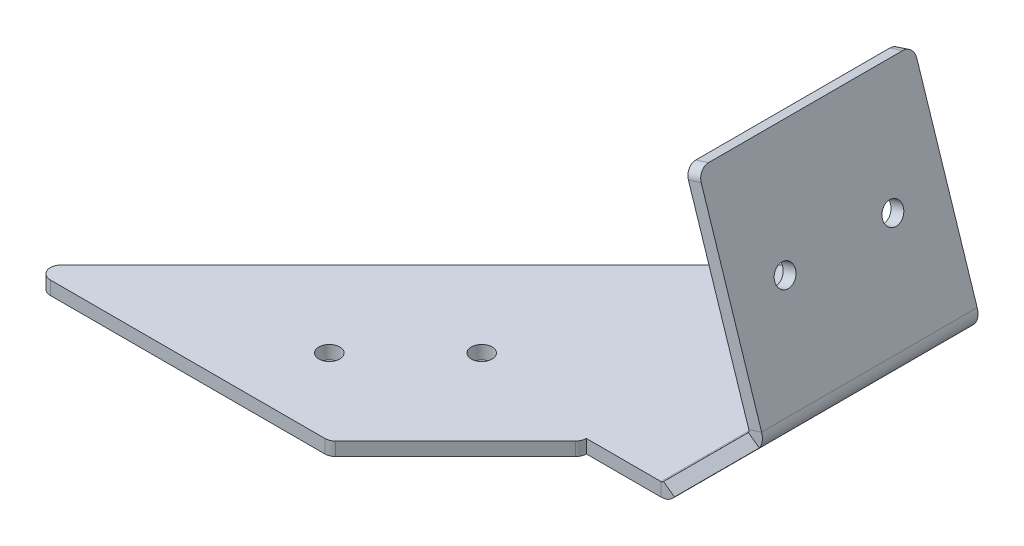
from build123d import *

# Parameters (mm, degrees)
SKETCH1_R                  = 2.4638
BASE_FLANGE1_DEPTH         = 3.175
SKETCHED_START             = -25.4
SKETCHED_BEND1_DEPTH       = 70.78994652
SKETCHED_START_2           = 25.4
SKETCHED_BEND1_2_DEPTH     = 19.98994652
SKETCHED_START_3           = -10.2361999
SKETCHED_BEND1_3_DEPTH     = 20.4723998
SKETCHED_START_4           = -22.86
SKETCHED_BEND1_4_DEPTH     = 7.6961999
SKETCHED_START_5           = 15.1638001
SKETCHED_BEND1_5_DEPTH     = 7.6961999
SKETCHED_BEND1_6_DEPTH     = 70.78994652
SKETCHED_BEND1_7_DEPTH     = 50.8
SKETCHED_START_6           = -15.866732383
SKETCHED_BEND1_8_OUTLINE_R = 2.4638
SKETCHED_BEND1_8_DEPTH     = 3.866732383


with BuildPart() as part:
    # Base-Flange1: sheet metal written as solids
    # Sketch1 → Base-Flange1 (new body)
    with BuildSketch(Plane(origin=(0, 0, 0), x_dir=(1, 0, 0), z_dir=(0, 1, 0))):
        with BuildLine():
            Line((-35.2933, 25.4), (-132.557248776, -71.863948776))
            ThreePointArc((-132.557248776, -71.863948776), (-133.107851564, -74.632015918), (-130.761197552, -76.2))
            Line((-130.761197552, -76.2), (-66.10335348, -76.2))
            ThreePointArc((-66.10335348, -76.2), (-65.131337562, -76.006654013), (-64.307302256, -75.456051224))
            Line((-64.307302256, -75.456051224), (-36.037248776, -47.185997744))
            ThreePointArc((-36.037248776, -47.185997744), (-35.486645987, -46.361962438), (-35.2933, -45.38994652))
            Line((-35.2933, -45.38994652), (-15.5067, -45.38994652))
            Line((-15.5067, -45.38994652), (-15.5067, -25.4))
            Line((-15.5067, -25.4), (32.7533, -25.4))
            ThreePointArc((32.7533, -25.4), (34.549351224, -24.656051224), (35.2933, -22.86))
            Line((35.2933, -22.86), (35.2933, 22.86))
            ThreePointArc((35.2933, 22.86), (34.549351224, 24.656051224), (32.7533, 25.4))
            Line((32.7533, 25.4), (-35.2933, 25.4))
        make_face()
        with Locations(Location((-83.011763274, -58.239487758, 0), (0, 0, 270))):
            Circle(SKETCH1_R, mode=Mode.SUBTRACT)
        with Locations(Location((-65.051251031, -40.278975516, 0), (0, 0, 270))):
            Circle(SKETCH1_R, mode=Mode.SUBTRACT)
        with Locations(Location((9.8933, -12.7, 0), (0, 0, 270))):
            Circle(SKETCH1_R, mode=Mode.SUBTRACT)
        with Locations(Location((9.8933, 12.7, 0), (0, 0, 270))):
            Circle(SKETCH1_R, mode=Mode.SUBTRACT)
    extrude(amount=-BASE_FLANGE1_DEPTH)

    # Sketched Bend1: read off the stored shape, not the designer's step
    # Sketched Bend1 outline → Sketched Bend1 (cut)
    with BuildSketch(Plane.XY.offset(SKETCHED_START)):
        with BuildLine():
            Line((35.2933, 0), (-13.855493847, 0))
            ThreePointArc((-13.855493847, 0), (-15.205192704, -2.278520157), (-17.697112646, -3.175))
            Line((-17.697112646, -3.175), (35.2933, -3.175))
            Line((35.2933, -3.175), (35.2933, 0))
        make_face()
    extrude(amount=SKETCHED_BEND1_DEPTH, mode=Mode.SUBTRACT)

    # Sketched Bend1 2 outline → Sketched Bend1 2 (cut)
    with BuildSketch(Plane.XY.offset(SKETCHED_START_2)):
        Polygon((-15.5067, -0.854827941), (-15.5067, 0), (-16.683269724, 0), align=None)
    extrude(amount=SKETCHED_BEND1_2_DEPTH, mode=Mode.SUBTRACT)

    # Sketched Bend1 3 outline → Sketched Bend1 3 (add)
    with BuildSketch(Plane.XY.offset(SKETCHED_START_3)):
        with BuildLine():
            ThreePointArc((-13.855493847, 0), (-13.793115407, 0.98036242), (-13.976959977, 1.945350875))
            Line((-13.976959977, 1.945350875), (-28.998148559, 48.175815683))
            Line((-28.998148559, 48.175815683), (-32.017752998, 47.194686726))
            Line((-32.017752998, 47.194686726), (-16.996564416, 0.964221918))
            ThreePointArc((-16.996564416, 0.964221918), (-17.101190728, 0.303637383), (-17.697112646, 0))
            Line((-17.697112646, 0), (-13.855493847, 0))
        make_face()
    extrude(amount=SKETCHED_BEND1_3_DEPTH)

    # Sketched Bend1 4 outline → Sketched Bend1 4 (add)
    with BuildSketch(Plane.XY.offset(SKETCHED_START_4)):
        with BuildLine():
            ThreePointArc((-13.855493847, 0), (-13.793115407, 0.98036242), (-13.976959977, 1.945350875))
            Line((-13.976959977, 1.945350875), (-28.998148559, 48.175815683))
            Line((-28.998148559, 48.175815683), (-32.017752998, 47.194686726))
            Line((-32.017752998, 47.194686726), (-16.996564416, 0.964221918))
            ThreePointArc((-16.996564416, 0.964221918), (-17.101190728, 0.303637383), (-17.697112646, 0))
            Line((-17.697112646, 0), (-13.855493847, 0))
        make_face()
    extrude(amount=SKETCHED_BEND1_4_DEPTH)

    # Sketched Bend1 5 outline → Sketched Bend1 5 (add)
    with BuildSketch(Plane.XY.offset(SKETCHED_START_5)):
        with BuildLine():
            ThreePointArc((-13.855493847, 0), (-13.793115407, 0.98036242), (-13.976959977, 1.945350875))
            Line((-13.976959977, 1.945350875), (-28.998148559, 48.175815683))
            Line((-28.998148559, 48.175815683), (-32.017752998, 47.194686726))
            Line((-32.017752998, 47.194686726), (-16.996564416, 0.964221918))
            ThreePointArc((-16.996564416, 0.964221918), (-17.101190728, 0.303637383), (-17.697112646, 0))
            Line((-17.697112646, 0), (-13.855493847, 0))
        make_face()
    extrude(amount=SKETCHED_BEND1_5_DEPTH)

    # Sketched Bend1 6 outline → Sketched Bend1 6 (add)
    with BuildSketch(Plane.XY.offset(SKETCHED_START)):
        with BuildLine():
            ThreePointArc((-15.5067, -2.504188021), (-14.978553355, -2.0758811), (-14.532561771, -1.562580793))
            Line((-14.532561771, -1.562580793), (-15.5067, -0.854827941))
            Line((-15.5067, -0.854827941), (-15.5067, -2.504188021))
        make_face()
        with BuildLine():
            Line((-17.697112646, 0), (-16.683269724, 0))
            Line((-16.683269724, 0), (-17.101190728, 0.303637383))
            ThreePointArc((-17.101190728, 0.303637383), (-17.362703244, 0.080284594), (-17.697112646, 0))
        make_face()
    extrude(amount=SKETCHED_BEND1_6_DEPTH)

    # Sketched Bend1 7 outline → Sketched Bend1 7 (add)
    with BuildSketch(Plane.XY.offset(SKETCHED_START)):
        with BuildLine():
            ThreePointArc((-13.855493847, 0), (-13.793115407, 0.98036242), (-13.976959977, 1.945350875))
            Line((-13.976959977, 1.945350875), (-28.998148559, 48.175815683))
            Line((-28.998148559, 48.175815683), (-32.017752998, 47.194686726))
            Line((-32.017752998, 47.194686726), (-16.996564416, 0.964221918))
            ThreePointArc((-16.996564416, 0.964221918), (-16.969581414, 0.621370373), (-17.101190728, 0.303637383))
            Line((-17.101190728, 0.303637383), (-16.683269724, 0))
            Line((-16.683269724, 0), (-13.855493847, 0))
        make_face()
    extrude(amount=SKETCHED_BEND1_7_DEPTH)

    # Sketched Bend1 8 outline → Sketched Bend1 8 (cut)
    with BuildSketch(Plane(origin=(0, 0, 0), x_dir=(-0.30901699437495117, 0.9510565162951524, 0), z_dir=(0.9510565162951524, 0.3090169943749511, 0)).offset(SKETCHED_START_6)):
        with BuildLine():
            Line((54.778844143, -25.4), (54.778844143, -22.86))
            ThreePointArc((54.778844143, -22.86), (54.034895367, -24.656051224), (52.238844143, -25.4))
            Line((52.238844143, -25.4), (54.778844143, -25.4))
        make_face()
        with BuildLine():
            ThreePointArc((52.238844143, 25.4), (54.034895367, 24.656051224), (54.778844143, 22.86))
            Line((54.778844143, 22.86), (54.778844143, 25.4))
            Line((54.778844143, 25.4), (52.238844143, 25.4))
        make_face()
        with Locations((29.378844143, 12.7)):
            Circle(SKETCHED_BEND1_8_OUTLINE_R)
        with Locations((29.378844143, -12.7)):
            Circle(SKETCHED_BEND1_8_OUTLINE_R)
    extrude(amount=SKETCHED_BEND1_8_DEPTH, mode=Mode.SUBTRACT)


solid = part.part
